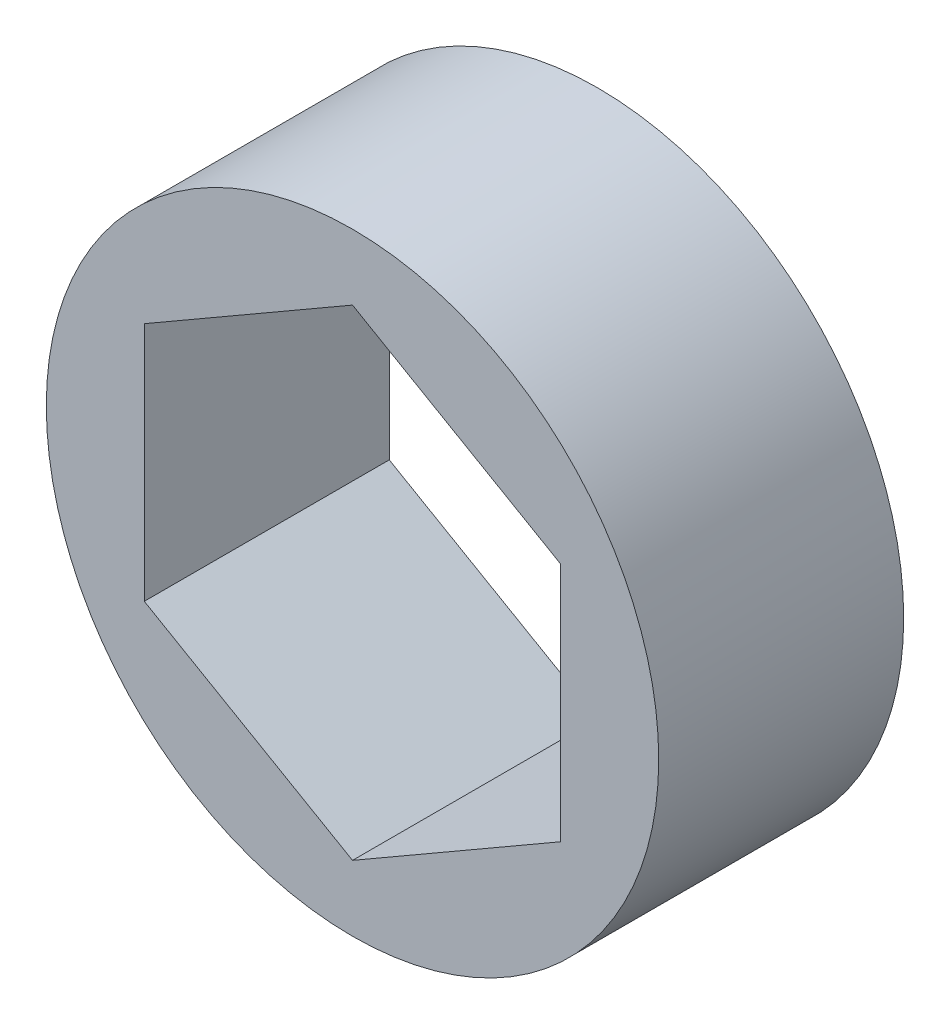
from build123d import *

# Parameters (mm, degrees)
SKETCH1_R           = 9.525
BOSS_EXTRUDE1_DEPTH = 7.62


with BuildPart() as part:
    # Sketch1 → Boss-Extrude1 (new body)
    with BuildSketch(Plane.XY):
        Circle(SKETCH1_R)
        Polygon((0, 7.478995387), (-6.477, 3.739497694), (-6.477, -3.739497694), (0, -7.478995387), (6.477, -3.739497694), (6.477, 3.739497694), align=None, mode=Mode.SUBTRACT)
    extrude(amount=BOSS_EXTRUDE1_DEPTH)


solid = part.part
